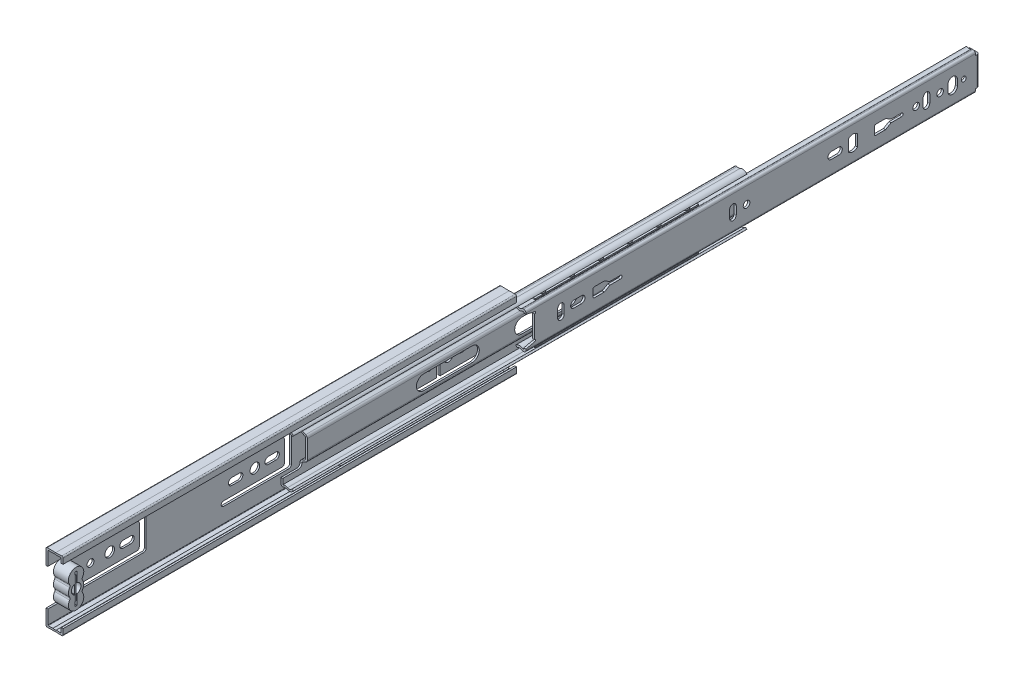
from build123d import *

# Parameters (mm, degrees)
BOSS_EXTRUDE1_START      = 4.826
BOSS_EXTRUDE1_DEPTH      = 299.974
BOSS_EXTRUDE2_DEPTH      = 152.4
BOSS_EXTRUDE2_DEPTH_BACK = 147.574
BOSS_EXTRUDE3_DEPTH      = 299.974
SKETCH8_W                = 2.667
SKETCH8_H                = 2.667
CUT_EXTRUDE1_DEPTH       = 306.916884359
SKETCH9_W                = 1.397
SKETCH9_H                = 18.9611
BOSS_EXTRUDE4_DEPTH      = 5.36016
FILLET1_R                = 1.651
FILLET2_R                = 0.254
SKETCH10_R               = 2.159
SKETCH10_R_2             = 3.175
SKETCH10_R_3             = 2.286
CUT_EXTRUDE3_DEPTH       = 306.916884359
CUT_EXTRUDE5_DEPTH       = 306.752331067
CUT_EXTRUDE6_DEPTH       = 306.916884359
CUT_EXTRUDE6_DEPTH_BACK  = 306.916884359
SKETCH12_R               = 2.1844
SKETCH13_W               = 1.1938
SKETCH13_H               = 14.986
BOSS_EXTRUDE5_DEPTH      = 9.398
FILLET3_R                = 1.524
FILLET4_R                = 0.254
BOSS_EXTRUDE6_DEPTH      = 9.906
FILLET5_R                = 1.524
BOSS_EXTRUDE7_DEPTH      = 0.381
BOSS_EXTRUDE7_DEPTH_BACK = 0.381
SKETCH15_W               = 7.62
SKETCH15_H               = 107.95
LPATTERN1_COUNT          = 6
LPATTERN1_PITCH          = 19.05
BOSS_EXTRUDE8_DEPTH      = 0.381
BOSS_EXTRUDE8_DEPTH_BACK = 0.381
SKETCH17_W               = 5.08
SKETCH17_H               = 107.95
LPATTERN2_COUNT          = 6
LPATTERN2_PITCH          = 19.05
CUT_EXTRUDE7_DEPTH       = 306.719107413
CUT_EXTRUDE7_DEPTH_BACK  = 306.719107413
SKETCH21_R               = 2.1844
SKETCH21_R_2             = 1.5875
CUT_EXTRUDE8_DEPTH       = 306.719107413
CUT_EXTRUDE8_DEPTH_BACK  = 306.719107413
SKETCH23_R               = 2.159


with BuildPart() as part:
    # Sketch5 → Boss-Extrude1 (new body)
    with BuildSketch(Plane.XY.offset(BOSS_EXTRUDE1_START)):
        with BuildLine():
            Line((4.9276, 18.415), (3.7338, 18.415))
            Line((3.7338, 18.415), (3.7338, 21.351668876))
            ThreePointArc((3.7338, 21.351668876), (3.656156384, 21.534465008), (3.470694285, 21.605505607))
            Line((3.470694285, 21.605505607), (0.424077102, 21.496216345))
            ThreePointArc((0.424077102, 21.496216345), (-0.671736167, 21.758871638), (-1.775065006, 21.529830168))
            Line((-1.775065006, 21.529830168), (-4.895551055, 21.611542971))
            ThreePointArc((-4.895551055, 21.611542971), (-5.079438777, 21.539570704), (-5.1562, 21.357630011))
            Line((-5.1562, 21.357630011), (-5.1562, -21.357630011))
            ThreePointArc((-5.1562, -21.357630011), (-5.079438777, -21.539570704), (-4.895551055, -21.611542971))
            Line((-4.895551055, -21.611542971), (-1.775065006, -21.529830168))
            ThreePointArc((-1.775065006, -21.529830168), (-0.671736167, -21.758871638), (0.424077102, -21.496216345))
            Line((0.424077102, -21.496216345), (3.470694285, -21.605505607))
            ThreePointArc((3.470694285, -21.605505607), (3.656156384, -21.534465008), (3.7338, -21.351668876))
            Line((3.7338, -21.351668876), (3.7338, -18.415))
            Line((3.7338, -18.415), (4.9276, -18.415))
            Line((4.9276, -18.415), (4.9276, -21.970365))
            ThreePointArc((4.9276, -21.970365), (4.667493886, -22.582732042), (4.046195853, -22.820718048))
            Line((4.046195853, -22.820718048), (0.032004, -22.676719627))
            Line((0.032004, -22.676719627), (-5.476826035, -22.820973418))
            ThreePointArc((-5.476826035, -22.820973418), (-6.092849902, -22.579866324), (-6.35, -21.970365))
            Line((-6.35, -21.970365), (-6.35, 21.970365))
            ThreePointArc((-6.35, 21.970365), (-6.092849902, 22.579866324), (-5.476826035, 22.820973418))
            Line((-5.476826035, 22.820973418), (0.032004, 22.676719627))
            Line((0.032004, 22.676719627), (4.046195853, 22.820718048))
            ThreePointArc((4.046195853, 22.820718048), (4.667493886, 22.582732042), (4.9276, 21.970365))
            Line((4.9276, 21.970365), (4.9276, 18.415))
        make_face()
    extrude(amount=BOSS_EXTRUDE1_DEPTH)

    # Sketch10 → Cut-Extrude3 (cut, through all)
    with BuildSketch(Plane(origin=(6.35, 0, 0), x_dir=(0, 0, -1), z_dir=(1, 0, 0))):
        with Locations(Location((-52.5172, 0, 0), (0, 0, 90))):
            Circle(SKETCH10_R)
        with Locations(Location((-30.9272, 0, 0), (0, 0, 90))):
            Circle(SKETCH10_R)
        with Locations(Location((-39.8272, 0, 0), (0, 0, 90))):
            Circle(SKETCH10_R_2)
        with Locations(Location((-167.8432, 0, 0), (0, 0, 90))):
            Circle(SKETCH10_R_2)
        with Locations(Location((-276.5552, 0, 0), (0, 0, 90))):
            Circle(SKETCH10_R_3)
        with Locations(Location((-263.8552, 0, 0), (0, 0, 90))):
            Circle(SKETCH10_R_2)
        with Locations(Location((-285.75, 0, 0), (0, 0, 90))):
            Circle(SKETCH10_R)
        with BuildLine():
            Line((-153.9367, 2.286), (-158.8897, 2.286))
            ThreePointArc((-158.8897, 2.286), (-161.1757, 0), (-158.8897, -2.286))
            Line((-158.8897, -2.286), (-153.9367, -2.286))
            ThreePointArc((-153.9367, -2.286), (-151.6507, 0), (-153.9367, 2.286))
        make_face()
        with BuildLine():
            Line((-178.0667, 2.286), (-183.0197, 2.286))
            ThreePointArc((-183.0197, 2.286), (-185.3057, 0), (-183.0197, -2.286))
            Line((-183.0197, -2.286), (-178.0667, -2.286))
            ThreePointArc((-178.0667, -2.286), (-175.7807, 0), (-178.0667, 2.286))
        make_face()
        with BuildLine():
            Line((-143.7132, -10.033), (-143.7132, 10.033))
            ThreePointArc((-143.7132, 10.033), (-144.159569265, 11.110630735), (-145.2372, 11.557))
            Line((-145.2372, 11.557), (-188.4934, 11.557))
            ThreePointArc((-188.4934, 11.557), (-190.0809, 9.9695), (-188.4934, 8.382))
            Line((-188.4934, 8.382), (-149.8092, 8.382))
            ThreePointArc((-149.8092, 8.382), (-148.731569265, 7.935630735), (-148.2852, 6.858))
            Line((-148.2852, 6.858), (-148.2852, -6.858))
            ThreePointArc((-148.2852, -6.858), (-148.731569265, -7.935630735), (-149.8092, -8.382))
            Line((-149.8092, -8.382), (-188.4934, -8.382))
            ThreePointArc((-188.4934, -8.382), (-190.0809, -9.9695), (-188.4934, -11.557))
            Line((-188.4934, -11.557), (-145.2372, -11.557))
            ThreePointArc((-145.2372, -11.557), (-144.159569265, -11.110630735), (-143.7132, -10.033))
        make_face()
        with BuildLine():
            Line((-254.9017, 2.286), (-249.9487, 2.286))
            ThreePointArc((-249.9487, 2.286), (-247.6627, 0), (-249.9487, -2.286))
            Line((-249.9487, -2.286), (-254.9017, -2.286))
            ThreePointArc((-254.9017, -2.286), (-257.1877, 0), (-254.9017, 2.286))
        make_face()
        with BuildLine():
            Line((-67.6937, 2.286), (-62.7407, 2.286))
            ThreePointArc((-62.7407, 2.286), (-60.4547, 0), (-62.7407, -2.286))
            Line((-62.7407, -2.286), (-67.6937, -2.286))
            ThreePointArc((-67.6937, -2.286), (-69.9797, 0), (-67.6937, 2.286))
        make_face()
        with BuildLine():
            Line((-284.5054, -8.382), (-245.8212, -8.382))
            ThreePointArc((-245.8212, -8.382), (-244.743569265, -7.935630735), (-244.2972, -6.858))
            Line((-244.2972, -6.858), (-244.2972, 6.858))
            ThreePointArc((-244.2972, 6.858), (-244.743569265, 7.935630735), (-245.8212, 8.382))
            Line((-245.8212, 8.382), (-284.5054, 8.382))
            ThreePointArc((-284.5054, 8.382), (-286.0929, 9.9695), (-284.5054, 11.557))
            Line((-284.5054, 11.557), (-241.2492, 11.557))
            ThreePointArc((-241.2492, 11.557), (-240.171569265, 11.110630735), (-239.7252, 10.033))
            Line((-239.7252, 10.033), (-239.7252, -10.033))
            ThreePointArc((-239.7252, -10.033), (-240.171569265, -11.110630735), (-241.2492, -11.557))
            Line((-241.2492, -11.557), (-284.5054, -11.557))
            ThreePointArc((-284.5054, -11.557), (-286.0929, -9.9695), (-284.5054, -8.382))
        make_face()
        with BuildLine():
            Line((-71.1708, 11.557), (-22.2758, 11.557))
            ThreePointArc((-22.2758, 11.557), (-20.6883, 9.9695), (-22.2758, 8.382))
            Line((-22.2758, 8.382), (-45.339, 8.382))
            Line((-45.339, 8.382), (-45.339, -8.382))
            Line((-45.339, -8.382), (-22.2758, -8.382))
            ThreePointArc((-22.2758, -8.382), (-20.6883, -9.9695), (-22.2758, -11.557))
            Line((-22.2758, -11.557), (-71.1708, -11.557))
            ThreePointArc((-71.1708, -11.557), (-72.7583, -9.9695), (-71.1708, -8.382))
            Line((-71.1708, -8.382), (-47.625, -8.382))
            Line((-47.625, -8.382), (-47.625, 8.382))
            Line((-47.625, 8.382), (-71.1708, 8.382))
            ThreePointArc((-71.1708, 8.382), (-72.7583, 9.9695), (-71.1708, 11.557))
        make_face()
        with BuildLine():
            Line((-296.5958, 7.493), (-296.5958, -7.493))
            Line((-296.5958, -7.493), (-295.140759713, -7.660376109))
            ThreePointArc((-295.140759713, -7.660376109), (-293.119747098, -10.062234601), (-295.402, -12.2174))
            Line((-295.402, -12.2174), (-304.8, -12.2174))
            Line((-304.8, -12.2174), (-304.8, 12.2174))
            Line((-304.8, 12.2174), (-295.402, 12.2174))
            ThreePointArc((-295.402, 12.2174), (-293.119747098, 10.062234601), (-295.140759713, 7.660376109))
            Line((-295.140759713, 7.660376109), (-296.5958, 7.493))
        make_face()
    extrude(amount=-CUT_EXTRUDE3_DEPTH, mode=Mode.SUBTRACT)

    # Sketch13 → Boss-Extrude5 (add)
    with BuildSketch(Plane(origin=(-5.1562, 0, 0), x_dir=(0, 0, -1), z_dir=(1, 0, 0))):
        with Locations((-295.9989, 0)):
            Rectangle(SKETCH13_W, SKETCH13_H)
    extrude(amount=BOSS_EXTRUDE5_DEPTH)

    # Fillet3
    # the kernel refuses this fillet: 1.524 mm, written as the material it takes off along each edge
    with BuildSketch(Plane(origin=(-6.35, -11.303, 296.5958), x_dir=(0, 0, -1), z_dir=(0, 1, 0))) as fillet3_piece_1:
        with BuildLine():
            CenterArc((FILLET3_R, -FILLET3_R), FILLET3_R, 90, 90)
            Line((0, -FILLET3_R), (0, 0))
            Line((0, 0), (FILLET3_R, 0))
        make_face()
    extrude(amount=22.606, mode=Mode.SUBTRACT)

    # Fillet4
    fillet4_edges = [part.edges().sort_by_distance(p)[0] for p in [
        (-5.1562, 0, 295.402),
    ]]
    fillet(fillet4_edges, radius=FILLET4_R)

    # Sketch23 → Cut-Extrude8 (cut, two sides: drawn at the far end of the back side and taken through both)
    with BuildSketch(Plane(origin=(0, 0, 0), x_dir=(0, 0, -1), z_dir=(1, 0, 0)).offset(-CUT_EXTRUDE8_DEPTH_BACK)):
        with Locations((-15.5194, 0)):
            Circle(SKETCH23_R)
    extrude(amount=CUT_EXTRUDE8_DEPTH + CUT_EXTRUDE8_DEPTH_BACK, mode=Mode.SUBTRACT)


with BuildPart() as body_2:
    # Sketch6 → Boss-Extrude2 (new, two sides: drawn at the far end of the back side and taken through both)
    with BuildSketch(Plane.XY.offset(-BOSS_EXTRUDE2_DEPTH_BACK)):
        with BuildLine():
            Line((-2.118971253, -9.521740172), (-2.118971253, -15.673265724))
            ThreePointArc((-2.118971253, -15.673265724), (-0.543137328, -15.404768735), (1.002576062, -15.812338741))
            ThreePointArc((1.002576062, -15.812338741), (2.613411889, -15.998010642), (3.953597112, -15.08522935))
            Line((3.953597112, -15.08522935), (4.9276, -15.77550235))
            ThreePointArc((4.9276, -15.77550235), (2.899013625, -17.157143977), (0.46075393, -16.876099624))
            ThreePointArc((0.46075393, -16.876099624), (-0.583547375, -16.597984033), (-1.65020857, -16.771614073))
            ThreePointArc((-1.65020857, -16.771614073), (-2.781285168, -16.642612521), (-3.312771253, -15.635886038))
            Line((-3.312771253, -15.635886038), (-3.312771253, -9.521740172))
            ThreePointArc((-3.312771253, -9.521740172), (-3.002498386, -8.457242188), (-2.168862554, -7.726163184))
            Line((-2.168862554, -7.726163184), (-0.196736138, -6.806545534))
            ThreePointArc((-0.196736138, -6.806545534), (0.123893028, -6.525361302), (0.243228747, -6.115939))
            Line((0.243228747, -6.115939), (0.243228747, 6.115939))
            ThreePointArc((0.243228747, 6.115939), (0.123893028, 6.525361302), (-0.196736138, 6.806545534))
            Line((-0.196736138, 6.806545534), (-2.168862554, 7.726163184))
            ThreePointArc((-2.168862554, 7.726163184), (-3.002498386, 8.457242188), (-3.312771253, 9.521740172))
            Line((-3.312771253, 9.521740172), (-3.312771253, 15.635886038))
            ThreePointArc((-3.312771253, 15.635886038), (-2.781285168, 16.642612521), (-1.65020857, 16.771614073))
            ThreePointArc((-1.65020857, 16.771614073), (-0.583547375, 16.597984033), (0.46075393, 16.876099624))
            ThreePointArc((0.46075393, 16.876099624), (2.899013625, 17.157143977), (4.9276, 15.77550235))
            Line((4.9276, 15.77550235), (3.953597112, 15.08522935))
            ThreePointArc((3.953597112, 15.08522935), (2.613411889, 15.998010642), (1.002576062, 15.812338741))
            ThreePointArc((1.002576062, 15.812338741), (-0.543137328, 15.404768735), (-2.118971253, 15.673265724))
            Line((-2.118971253, 15.673265724), (-2.118971253, 9.521740172))
            ThreePointArc((-2.118971253, 9.521740172), (-1.995657678, 9.09867046), (-1.664340873, 8.80811342))
            Line((-1.664340873, 8.80811342), (0.307785543, 7.88849577))
            ThreePointArc((0.307785543, 7.88849577), (1.130733736, 7.166789574), (1.437028747, 6.115939))
            Line((1.437028747, 6.115939), (1.437028747, -6.115939))
            ThreePointArc((1.437028747, -6.115939), (1.130733736, -7.166789574), (0.307785543, -7.88849577))
            Line((0.307785543, -7.88849577), (-1.664340873, -8.80811342))
            ThreePointArc((-1.664340873, -8.80811342), (-1.995657678, -9.09867046), (-2.118971253, -9.521740172))
        make_face()
    extrude(amount=BOSS_EXTRUDE2_DEPTH + BOSS_EXTRUDE2_DEPTH_BACK)

    # Sketch11 → Cut-Extrude5 (cut, through all)
    with BuildSketch(Plane(origin=(1.437028747, 0, 0), x_dir=(0, 0, -1), z_dir=(1, 0, 0))):
        with BuildLine():
            Line((-152.4, 12.065), (-152.4, -12.065))
            Line((-152.4, -12.065), (-142.24, -12.065))
            ThreePointArc((-142.24, -12.065), (-140.443948776, -11.321051224), (-139.7, -9.525))
            Line((-139.7, -9.525), (-139.7, 9.525))
            ThreePointArc((-139.7, 9.525), (-140.443948776, 11.321051224), (-142.24, 12.065))
            Line((-142.24, 12.065), (-152.4, 12.065))
        make_face()
        with BuildLine():
            Line((34.2265, -4.826), (2.286, -4.826))
            ThreePointArc((2.286, -4.826), (-2.54, 0), (2.286, 4.826))
            Line((2.286, 4.826), (34.2265, 4.826))
            ThreePointArc((34.2265, 4.826), (39.0525, 0), (34.2265, -4.826))
        make_face()
        with BuildLine():
            Line((-30.8002, 4.826), (-62.7407, 4.826))
            ThreePointArc((-62.7407, 4.826), (-67.5667, 0), (-62.7407, -4.826))
            Line((-62.7407, -4.826), (-30.8002, -4.826))
            ThreePointArc((-30.8002, -4.826), (-25.9742, 0), (-30.8002, 4.826))
        make_face()
    extrude(amount=-CUT_EXTRUDE5_DEPTH, mode=Mode.SUBTRACT)


with BuildPart() as body_3:
    # Sketch7 → Boss-Extrude3 (new body)
    with BuildSketch(Plane.XY):
        with BuildLine():
            Line((0.518100184, 12.000136985), (-0.407162, 10.953476156))
            ThreePointArc((-0.407162, 10.953476156), (1.785052967, 10.030279913), (4.088556466, 10.62355))
            Line((4.088556466, 10.62355), (4.953, 10.62355))
            Line((4.953, 10.62355), (4.953, -10.62355))
            ThreePointArc((4.953, -10.62355), (4.915802561, -10.713352561), (4.826, -10.75055))
            Line((4.826, -10.75055), (4.271310903, -10.75055))
            ThreePointArc((4.271310903, -10.75055), (1.896150971, -10.0237954), (-0.407162, -10.953476156))
            Line((-0.407162, -10.953476156), (0.518100184, -12.000136985))
            ThreePointArc((0.518100184, -12.000136985), (1.943956939, -11.42007032), (3.419579752, -11.858342079))
            ThreePointArc((3.419579752, -11.858342079), (3.84336969, -12.073446398), (4.312812376, -12.14755))
            Line((4.312812376, -12.14755), (4.826, -12.14755))
            ThreePointArc((4.826, -12.14755), (5.903630735, -11.701180735), (6.35, -10.62355))
            Line((6.35, -10.62355), (6.35, 10.62355))
            ThreePointArc((6.35, 10.62355), (5.903630735, 11.701180735), (4.826, 12.14755))
            Line((4.826, 12.14755), (4.312812376, 12.14755))
            ThreePointArc((4.312812376, 12.14755), (3.84336969, 12.073446398), (3.419579752, 11.858342079))
            ThreePointArc((3.419579752, 11.858342079), (1.943956939, 11.42007032), (0.518100184, 12.000136985))
        make_face()
    extrude(amount=-BOSS_EXTRUDE3_DEPTH)

    # Sketch8 → Cut-Extrude1 (cut, through all)
    with BuildSketch(Plane(origin=(6.35, 0, 0), x_dir=(0, 0, -1), z_dir=(1, 0, 0))):
        with Locations((298.6405, 10.81405)):
            Rectangle(SKETCH8_W, SKETCH8_H)
        with Locations((298.6405, -10.81405)):
            Rectangle(SKETCH8_W, SKETCH8_H)
    extrude(amount=-CUT_EXTRUDE1_DEPTH, mode=Mode.SUBTRACT)

    # Sketch9 → Boss-Extrude4 (add)
    with BuildSketch(Plane.ZY.offset(-4.953)):
        with Locations((-299.2755, 0)):
            Rectangle(SKETCH9_W, SKETCH9_H)
    extrude(amount=BOSS_EXTRUDE4_DEPTH)

    # Fillet1
    fillet1_edges = [body_3.edges().sort_by_distance(p)[0] for p in [
        (6.35, 0, -299.974),
    ]]
    fillet(fillet1_edges, radius=FILLET1_R)

    # Fillet2
    fillet2_edges = [body_3.edges().sort_by_distance(p)[0] for p in [
        (4.953, 0, -298.577),
    ]]
    fillet(fillet2_edges, radius=FILLET2_R)

    # Sketch12 → Cut-Extrude6 (cut, two sides: drawn at the far end of the back side and taken through both)
    with BuildSketch(Plane(origin=(6.35, 0, 0), x_dir=(0, 0, -1), z_dir=(1, 0, 0)).offset(-CUT_EXTRUDE6_DEPTH_BACK)):
        with Locations(Location((273.9136, 0, 0), (0, 0, 90))):
            Circle(SKETCH12_R)
        with BuildLine():
            Line((5.715, 7.331475009), (5.715, -7.331475009))
            ThreePointArc((5.715, -7.331475009), (6.345918128, -7.894590968), (5.85784392, -8.5852))
            Line((5.85784392, -8.5852), (0, -9.93758983))
            Line((0, -9.93758983), (0, 9.93758983))
            Line((0, 9.93758983), (5.85784392, 8.5852))
            ThreePointArc((5.85784392, 8.5852), (6.345918128, 7.894590968), (5.715, 7.331475009))
        make_face()
        with BuildLine():
            Line((267.1064, -2.6416), (267.1064, 2.6416))
            ThreePointArc((267.1064, 2.6416), (264.922, 4.826), (262.7376, 2.6416))
            Line((262.7376, 2.6416), (262.7376, -2.6416))
            ThreePointArc((262.7376, -2.6416), (264.922, -4.826), (267.1064, -2.6416))
        make_face()
        with BuildLine():
            Line((201.9935, -2.286), (206.9465, -2.286))
            ThreePointArc((206.9465, -2.286), (209.2325, 0), (206.9465, 2.286))
            Line((206.9465, 2.286), (201.9935, 2.286))
            ThreePointArc((201.9935, 2.286), (199.7075, 0), (201.9935, -2.286))
        make_face()
        with BuildLine():
            Line((139.0904, -2.6416), (139.0904, 2.6416))
            ThreePointArc((139.0904, 2.6416), (136.906, 4.826), (134.7216, 2.6416))
            Line((134.7216, 2.6416), (134.7216, -2.6416))
            ThreePointArc((134.7216, -2.6416), (136.906, -4.826), (139.0904, -2.6416))
        make_face()
        with BuildLine():
            Line((36.7665, -2.286), (31.8135, -2.286))
            ThreePointArc((31.8135, -2.286), (29.5275, 0), (31.8135, 2.286))
            Line((31.8135, 2.286), (36.7665, 2.286))
            ThreePointArc((36.7665, 2.286), (39.0525, 0), (36.7665, -2.286))
        make_face()
        with BuildLine():
            Line((20.9296, -2.6416), (20.9296, 2.6416))
            ThreePointArc((20.9296, 2.6416), (23.114, 4.826), (25.2984, 2.6416))
            Line((25.2984, 2.6416), (25.2984, -2.6416))
            ThreePointArc((25.2984, -2.6416), (23.114, -4.826), (20.9296, -2.6416))
        make_face()
    extrude(amount=CUT_EXTRUDE6_DEPTH + CUT_EXTRUDE6_DEPTH_BACK, mode=Mode.SUBTRACT)

    # Sketch21 → Cut-Extrude7 (cut, two sides: drawn at the far end of the back side and taken through both)
    with BuildSketch(Plane(origin=(0, 0, 0), x_dir=(0, 0, -1), z_dir=(1, 0, 0)).offset(-CUT_EXTRUDE7_DEPTH_BACK)):
        with Locations((145.8976, 0)):
            Circle(SKETCH21_R)
        with Locations((258.064, 0)):
            Circle(SKETCH21_R)
        with Locations(Location((273.9136, 0, 0), (0, 0, 90))):
            Circle(SKETCH21_R)
        with Locations((289.56, 0)):
            Circle(SKETCH21_R_2)
        with BuildLine():
            Line((248.49455, 1.06045), (241.533508035, 1.06045))
            Line((241.533508035, 1.06045), (237.871, 3.175))
            Line((237.871, 3.175), (231.267, 3.175))
            ThreePointArc((231.267, 3.175), (230.728184633, 2.951815367), (230.505, 2.413))
            Line((230.505, 2.413), (230.505, -2.413))
            ThreePointArc((230.505, -2.413), (230.728184633, -2.951815367), (231.267, -3.175))
            Line((231.267, -3.175), (237.871, -3.175))
            Line((237.871, -3.175), (241.533508035, -1.06045))
            Line((241.533508035, -1.06045), (248.49455, -1.06045))
            ThreePointArc((248.49455, -1.06045), (249.555, 0), (248.49455, 1.06045))
        make_face()
        with BuildLine():
            Line((285.369, -1.905), (285.369, 1.905))
            ThreePointArc((285.369, 1.905), (282.194, 5.08), (279.019, 1.905))
            Line((279.019, 1.905), (279.019, -1.905))
            ThreePointArc((279.019, -1.905), (282.194, -5.08), (285.369, -1.905))
        make_face()
        with BuildLine():
            Line((219.23375, -3.81), (219.23375, 3.81))
            ThreePointArc((219.23375, 3.81), (216.24925, 5.08), (213.26475, 3.81))
            Line((213.26475, 3.81), (213.26475, -3.81))
            ThreePointArc((213.26475, -3.81), (216.24925, -5.08), (219.23375, -3.81))
        make_face()
        with BuildLine():
            Line((62.43955, 1.06045), (55.478508035, 1.06045))
            Line((55.478508035, 1.06045), (51.816, 3.175))
            Line((51.816, 3.175), (45.212, 3.175))
            ThreePointArc((45.212, 3.175), (44.673184633, 2.951815367), (44.45, 2.413))
            Line((44.45, 2.413), (44.45, -2.413))
            ThreePointArc((44.45, -2.413), (44.673184633, -2.951815367), (45.212, -3.175))
            Line((45.212, -3.175), (51.816, -3.175))
            Line((51.816, -3.175), (55.478508035, -1.06045))
            Line((55.478508035, -1.06045), (62.43955, -1.06045))
            ThreePointArc((62.43955, -1.06045), (63.5, 0), (62.43955, 1.06045))
        make_face()
    extrude(amount=CUT_EXTRUDE7_DEPTH + CUT_EXTRUDE7_DEPTH_BACK, mode=Mode.SUBTRACT)


with BuildPart() as body_4:
    # Sketch14 → Boss-Extrude6 (new body)
    with BuildSketch(Plane(origin=(-5.1562, 0, 0), x_dir=(0, 0, -1), z_dir=(1, 0, 0))):
        with BuildLine():
            ThreePointArc((-292.421555488, -3.6068), (-290.9189, 0), (-292.421555488, 3.6068))
            ThreePointArc((-292.421555488, 3.6068), (-295.9989, 12.2936), (-299.576244512, 3.6068))
            ThreePointArc((-299.576244512, 3.6068), (-301.0789, 0), (-299.576244512, -3.6068))
            ThreePointArc((-299.576244512, -3.6068), (-295.9989, -12.2936), (-292.421555488, -3.6068))
        make_face()
        with BuildLine():
            Line((-295.3004, -3.097212093), (-295.3004, -9.8552))
            Line((-295.3004, -9.8552), (-296.6974, -9.8552))
            Line((-296.6974, -9.8552), (-296.6974, -3.097212093))
            ThreePointArc((-296.6974, -3.097212093), (-299.1739, 0), (-296.6974, 3.097212093))
            Line((-296.6974, 3.097212093), (-296.6974, 9.8552))
            Line((-296.6974, 9.8552), (-295.3004, 9.8552))
            Line((-295.3004, 9.8552), (-295.3004, 3.097212093))
            ThreePointArc((-295.3004, 3.097212093), (-292.8239, 0), (-295.3004, -3.097212093))
        make_face(mode=Mode.SUBTRACT)
    extrude(amount=BOSS_EXTRUDE6_DEPTH)

    # Fillet5
    fillet5_edges = [body_4.edges().sort_by_distance(p)[0] for p in [
        (-0.2032, -3.6068, 299.576244512),
        (-0.2032, 3.6068, 299.576244512),
        (-0.2032, 3.6068, 292.421555488),
        (-0.2032, -3.6068, 292.421555488),
    ]]
    fillet(fillet5_edges, radius=FILLET5_R)


with BuildPart() as body_5:
    # Sketch15 → Boss-Extrude7 (new, two sides: drawn at the far end of the back side and taken through both)
    with BuildSketch(Plane(origin=(0, -19.177, 0), x_dir=(1, 0, 0), z_dir=(0, 1, 0)).offset(-BOSS_EXTRUDE7_DEPTH_BACK)):
        with Locations((-0.7112, -65.151)):
            Rectangle(SKETCH15_W, SKETCH15_H)
    extrude(amount=BOSS_EXTRUDE7_DEPTH + BOSS_EXTRUDE7_DEPTH_BACK)


with BuildPart() as body_6:
    # Sketch16 → Revolve1 (revolve)
    with BuildSketch(Plane(origin=(0, -19.177, 0), x_dir=(1, 0, 0), z_dir=(0, 1, 0))):
        with BuildLine():
            Line((-0.7112, -110.236), (-0.7112, -115.316))
            ThreePointArc((-0.7112, -115.316), (1.8288, -112.776), (-0.7112, -110.236))
        make_face()
    revolve(axis=Axis((-0.7112, -19.177, 110.236), (0, 0, 1)))


with BuildPart() as lpattern1_1:
    # LPattern1: pattern copy
    add(body_6.part.moved(Location(Vector(0, 0, -1) * (1 * LPATTERN1_PITCH))))


with BuildPart() as lpattern1_2:
    # LPattern1: pattern copy
    add(body_6.part.moved(Location(Vector(0, 0, -1) * (2 * LPATTERN1_PITCH))))


with BuildPart() as lpattern1_3:
    # LPattern1: pattern copy
    add(body_6.part.moved(Location(Vector(0, 0, -1) * (3 * LPATTERN1_PITCH))))


with BuildPart() as lpattern1_4:
    # LPattern1: pattern copy
    add(body_6.part.moved(Location(Vector(0, 0, -1) * (4 * LPATTERN1_PITCH))))


with BuildPart() as lpattern1_5:
    # LPattern1: pattern copy
    add(body_6.part.moved(Location(Vector(0, 0, -1) * (5 * LPATTERN1_PITCH))))


with BuildPart() as body_12:
    # Sketch17 → Boss-Extrude8 (new, two sides: drawn at the far end of the back side and taken through both)
    with BuildSketch(Plane(origin=(0, -13.7414, 0), x_dir=(1, 0, 0), z_dir=(0, 1, 0)).offset(-BOSS_EXTRUDE8_DEPTH_BACK)):
        with Locations((2.0574, 61.9125)):
            Rectangle(SKETCH17_W, SKETCH17_H)
    extrude(amount=BOSS_EXTRUDE8_DEPTH + BOSS_EXTRUDE8_DEPTH_BACK)


with BuildPart() as body_13:
    # Sketch19 → Revolve2 (revolve)
    with BuildSketch(Plane(origin=(0, -13.7414, 0), x_dir=(1, 0, 0), z_dir=(0, 1, 0))):
        with BuildLine():
            Line((2.0574, 11.9888), (2.0574, 16.5862))
            ThreePointArc((2.0574, 16.5862), (4.3561, 14.2875), (2.0574, 11.9888))
        make_face()
    revolve(axis=Axis((2.0574, -13.7414, -14.2875), (0, 0, 1)))


with BuildPart() as lpattern2_1:
    # LPattern2: pattern copy
    add(body_13.part.moved(Location(Vector(0, 0, -1) * (1 * LPATTERN2_PITCH))))


with BuildPart() as lpattern2_2:
    # LPattern2: pattern copy
    add(body_13.part.moved(Location(Vector(0, 0, -1) * (2 * LPATTERN2_PITCH))))


with BuildPart() as lpattern2_3:
    # LPattern2: pattern copy
    add(body_13.part.moved(Location(Vector(0, 0, -1) * (3 * LPATTERN2_PITCH))))


with BuildPart() as lpattern2_4:
    # LPattern2: pattern copy
    add(body_13.part.moved(Location(Vector(0, 0, -1) * (4 * LPATTERN2_PITCH))))


with BuildPart() as lpattern2_5:
    # LPattern2: pattern copy
    add(body_13.part.moved(Location(Vector(0, 0, -1) * (5 * LPATTERN2_PITCH))))


with BuildPart() as body_19:
    # Mirror1: mirrored copy
    add(body_5.part.mirror(Plane.ZX))


with BuildPart() as body_20:
    # Mirror1 2: mirrored copy
    add(body_6.part.mirror(Plane.ZX))


with BuildPart() as body_21:
    # Mirror1 3: mirrored copy
    add(lpattern1_1.part.mirror(Plane.ZX))


with BuildPart() as body_22:
    # Mirror1 4: mirrored copy
    add(lpattern1_2.part.mirror(Plane.ZX))


with BuildPart() as body_23:
    # Mirror1 5: mirrored copy
    add(lpattern1_3.part.mirror(Plane.ZX))


with BuildPart() as body_24:
    # Mirror1 6: mirrored copy
    add(lpattern1_4.part.mirror(Plane.ZX))


with BuildPart() as body_25:
    # Mirror1 7: mirrored copy
    add(lpattern1_5.part.mirror(Plane.ZX))


with BuildPart() as body_26:
    # Mirror1 8: mirrored copy
    add(body_12.part.mirror(Plane.ZX))


with BuildPart() as body_27:
    # Mirror1 9: mirrored copy
    add(body_13.part.mirror(Plane.ZX))


with BuildPart() as body_28:
    # Mirror1 10: mirrored copy
    add(lpattern2_1.part.mirror(Plane.ZX))


with BuildPart() as body_29:
    # Mirror1 11: mirrored copy
    add(lpattern2_2.part.mirror(Plane.ZX))


with BuildPart() as body_30:
    # Mirror1 12: mirrored copy
    add(lpattern2_3.part.mirror(Plane.ZX))


with BuildPart() as body_31:
    # Mirror1 13: mirrored copy
    add(lpattern2_4.part.mirror(Plane.ZX))


with BuildPart() as body_32:
    # Mirror1 14: mirrored copy
    add(lpattern2_5.part.mirror(Plane.ZX))


solid = Compound([part.part, body_2.part, body_3.part, body_4.part, body_5.part, body_6.part, lpattern1_1.part, lpattern1_2.part, lpattern1_3.part, lpattern1_4.part, lpattern1_5.part, body_12.part, body_13.part, lpattern2_1.part, lpattern2_2.part, lpattern2_3.part, lpattern2_4.part, lpattern2_5.part, body_19.part, body_20.part, body_21.part, body_22.part, body_23.part, body_24.part, body_25.part, body_26.part, body_27.part, body_28.part, body_29.part, body_30.part, body_31.part, body_32.part])
